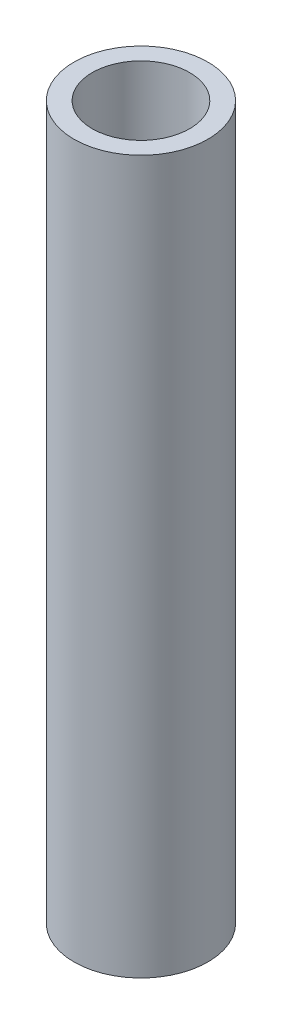
from build123d import *

# Parameters (mm, degrees)
SKETCH1_R           = 16.7005
SKETCH1_R_2         = 12.1539
BOSS_EXTRUDE1_DEPTH = 88.9


with BuildPart() as part:
    # Sketch1 → Boss-Extrude1 (new, symmetric)
    with BuildSketch(Plane(origin=(0, 0, 0), x_dir=(1, 0, 0), z_dir=(0, 1, 0))):
        Circle(SKETCH1_R)
        Circle(SKETCH1_R_2, mode=Mode.SUBTRACT)
    extrude(amount=BOSS_EXTRUDE1_DEPTH, both=True)


solid = part.part
